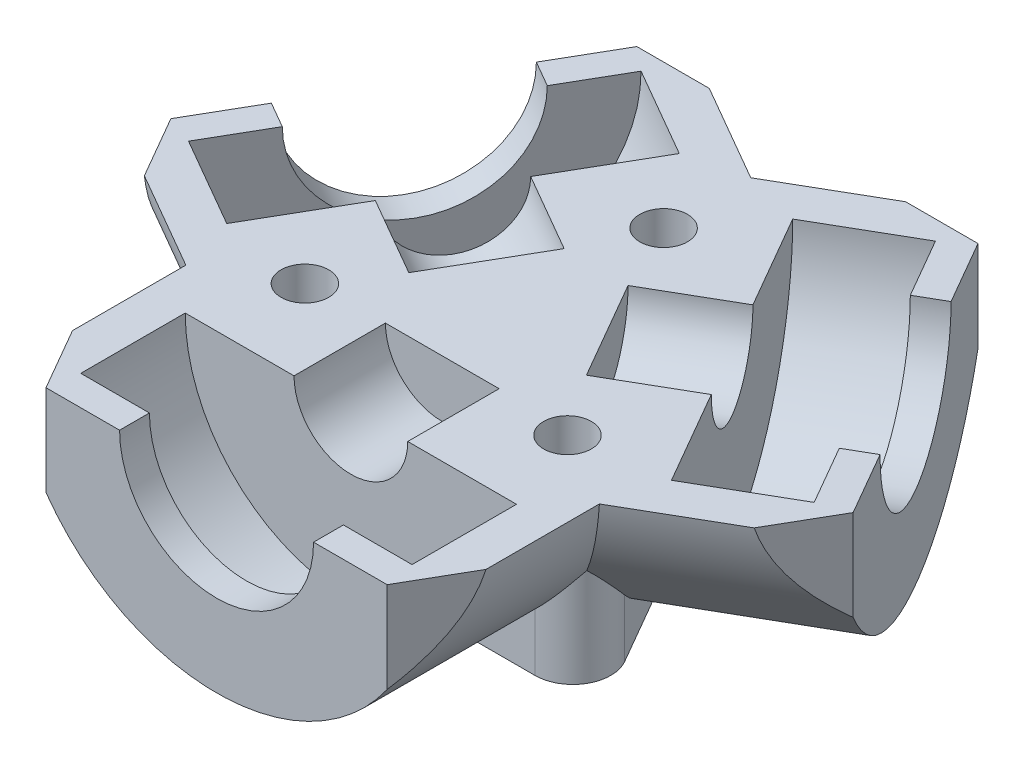
from build123d import *

# Parameters (mm, degrees)
BOSS_EXTRUDE1_DEPTH = 12.7
SKETCH7_R           = 1.6
CUT_EXTRUDE2_DEPTH  = 12.7
CIRPATTERN1_COUNT   = 3
CUT_EXTRUDE3_DEPTH  = 11.684
CIRPATTERN2_COUNT   = 3
CUT_EXTRUDE5_DEPTH  = 0.7
FILLET2_R           = 2.54


with BuildPart() as part:
    # Sketch1 → Boss-Extrude1 (new body)
    with BuildSketch(Plane(origin=(0, 0, 0), x_dir=(1, 0, 0), z_dir=(0, 1, 0))):
        Polygon((11.43, -19.797340731), (22.86, 0), (11.43, 19.797340731), (-11.43, 19.797340731), (-22.86, 0), (-11.43, -19.797340731), align=None)
    extrude(amount=BOSS_EXTRUDE1_DEPTH)

    # Sketch5 → Cut-Revolve1 (revolve, cut)
    with BuildSketch(Plane(origin=(0, 12.7, 0), x_dir=(1, 0, 0), z_dir=(0, 1, 0))):
        Polygon((0, -19.797340731), (0, -4.672340739), (-3.81, -4.672340739), (-3.81, -10.797340731), (-11.100000152, -10.797340731), (-11.100000152, -17.797340731), (-6.5, -17.797340731), (-6.5, -19.797340731), align=None)
    cut_revolve1 = revolve(axis=Axis((0, 12.7, 19.797340731), (0, 0, -1)), mode=Mode.SUBTRACT)

    # Sketch7 → Cut-Extrude2 (cut)
    with BuildSketch(Plane(origin=(0, 12.7, 0), x_dir=(1, 0, 0), z_dir=(0, 1, 0))):
        with Locations(Location((0, 10.16, 0), (0, 0, 270))):
            Circle(SKETCH7_R)
        with Locations(Location((8.798818102, -5.08, 0), (0, 0, 270))):
            Circle(SKETCH7_R)
        with Locations(Location((-8.798818102, -5.08, 0), (0, 0, 270))):
            Circle(SKETCH7_R)
    extrude(amount=-CUT_EXTRUDE2_DEPTH, mode=Mode.SUBTRACT)

    # CirPattern1: Cut-Revolve1 ×3 about axis
    cirpattern1_axis = Axis((0, 0, 0), (0, 1, 0))
    for i in range(1, CIRPATTERN1_COUNT):
        add(cut_revolve1.rotate(cirpattern1_axis, i * 360 / CIRPATTERN1_COUNT), mode=Mode.SUBTRACT)

    # Sketch8 → Cut-Extrude3 (cut)
    with BuildSketch(Plane.XY.offset(19.797340731)):
        with BuildLine():
            Line((-13.856406592, 12.7), (-18.662949192, 12.7))
            Line((-18.662949192, 12.7), (-18.662949192, 0))
            Line((-18.662949192, 0), (18.662949192, 0))
            Line((18.662949192, 0), (18.662949192, 12.7))
            Line((18.662949192, 12.7), (13.856406592, 12.7))
            ThreePointArc((13.856406592, 12.7), (0, 0.69999987), (-13.856406592, 12.7))
        make_face()
    cut_extrude3 = extrude(amount=-CUT_EXTRUDE3_DEPTH, mode=Mode.SUBTRACT)

    # CirPattern2: Cut-Extrude3 ×3 about axis
    cirpattern2_axis = Axis((0, 0, 0), (0, 1, 0))
    for i in range(1, CIRPATTERN2_COUNT):
        add(cut_extrude3.rotate(cirpattern2_axis, i * 360 / CIRPATTERN2_COUNT), mode=Mode.SUBTRACT)

    # Sketch10 → Cut-Extrude5 (cut)
    with BuildSketch(Plane.XZ):
        Polygon((14.052718364, 8.113340731), (-14.052718364, 8.113340731), (0, -16.226681461), align=None)
    extrude(amount=-CUT_EXTRUDE5_DEPTH, mode=Mode.SUBTRACT)

    # Fillet2
    # the kernel refuses this fillet: 2.54 mm, written as the material it takes off along each edge
    with BuildSketch(Plane(origin=(14.052718364, -10.298522628, 8.113340731), x_dir=(-0.4999999999999996, 0, -0.8660254037844387), z_dir=(0, 1, 0))) as fillet2_piece_1_section:
        with BuildLine():
            CenterArc((FILLET2_R * 1.73205080757, FILLET2_R), FILLET2_R, 150, 120)
            Line((FILLET2_R * 0.866025403784, FILLET2_R * 1.5), (0, 0))
            Line((0, 0), (FILLET2_R * 1.73205080757, 0))
        make_face()
    fillet2_piece_1 = extrude(amount=33.997045256, mode=Mode.PRIVATE)
    fillet2_piece_1 = fillet2_piece_1 - Plane(origin=(6.277314066, 14.7, -3.624208966), x_dir=(-0.49487165940112743, -0.14285714153061227, -0.8571428573086736), z_dir=(0.8660254037844388, 0, -0.49999999999999983)) * Cylinder(14.00000013, 86, mode=Mode.PRIVATE)
    fillet2_piece_1 = fillet2_piece_1 - Plane(origin=(0, 14.7, 7.248417919), x_dir=(0.9897433188022552, -0.14285714153061224, 0), z_dir=(0, 0, 1)) * Cylinder(14.00000013, 86, mode=Mode.PRIVATE)
    add(fillet2_piece_1, mode=Mode.SUBTRACT)
    with BuildSketch(Plane(origin=(0, -10.298522628, -16.226681461), x_dir=(-0.5000000000000003, 0, 0.8660254037844386), z_dir=(0, 1, 0))) as fillet2_piece_2_section:
        with BuildLine():
            CenterArc((FILLET2_R * 1.73205080757, FILLET2_R), FILLET2_R, 150, 120)
            Line((FILLET2_R * 0.866025403784, FILLET2_R * 1.5), (0, 0))
            Line((0, 0), (FILLET2_R * 1.73205080757, 0))
        make_face()
    fillet2_piece_2 = extrude(amount=33.997045256, mode=Mode.PRIVATE)
    fillet2_piece_2 = fillet2_piece_2 - Plane(origin=(6.277314055, 14.7, -3.62420896), x_dir=(-0.49487165940112743, -0.14285714153061227, -0.8571428573086736), z_dir=(0.8660254037844388, 0, -0.49999999999999983)) * Cylinder(14.00000013, 86, mode=Mode.PRIVATE)
    fillet2_piece_2 = fillet2_piece_2 - Plane(origin=(-6.277314066, 14.7, -3.624208966), x_dir=(-0.4948716594011281, -0.14285714153061227, 0.8571428573086732), z_dir=(-0.8660254037844384, 0, -0.5000000000000004)) * Cylinder(14.00000013, 86, mode=Mode.PRIVATE)
    add(fillet2_piece_2, mode=Mode.SUBTRACT)
    with BuildSketch(Plane(origin=(-14.052718364, 23.698522628, 8.113340731), x_dir=(1, 0, 0), z_dir=(0, -1, 0))) as fillet2_piece_3_section:
        with BuildLine():
            CenterArc((FILLET2_R * 1.73205080757, -FILLET2_R), FILLET2_R, 90, 120)
            Line((FILLET2_R * 0.866025403784, -FILLET2_R * 1.5), (0, 0))
            Line((0, 0), (FILLET2_R * 1.73205080757, 0))
        make_face()
    fillet2_piece_3 = extrude(amount=33.997045256, mode=Mode.PRIVATE)
    fillet2_piece_3 = fillet2_piece_3 - Plane(origin=(0, 14.7, 7.248417932), x_dir=(0.9897433188022552, -0.14285714153061224, 0), z_dir=(0, 0, 1)) * Cylinder(14.00000013, 86, mode=Mode.PRIVATE)
    fillet2_piece_3 = fillet2_piece_3 - Plane(origin=(-6.277314055, 14.7, -3.62420896), x_dir=(-0.4948716594011281, -0.14285714153061227, 0.8571428573086732), z_dir=(-0.8660254037844384, 0, -0.5000000000000004)) * Cylinder(14.00000013, 86, mode=Mode.PRIVATE)
    add(fillet2_piece_3, mode=Mode.SUBTRACT)


solid = part.part
